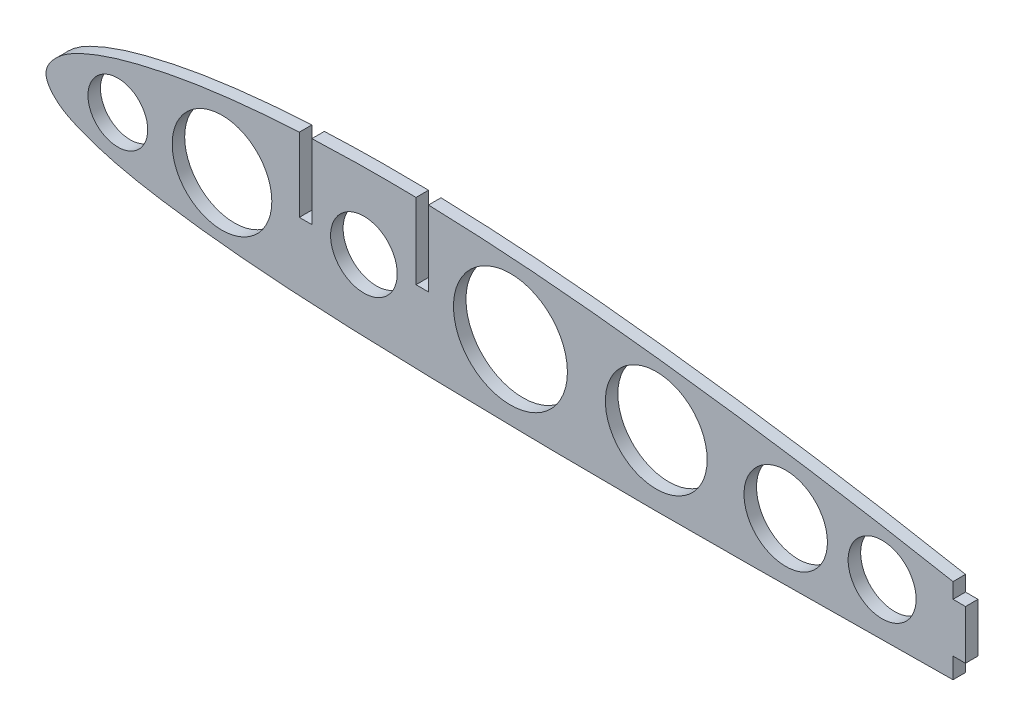
from build123d import *

# Parameters (mm, degrees)
STOCK_WING_STRUCTURESIZING_1_START = 350.5
STOCK_WING_STRUCTURESIZING_1_DEPTH = 3
CUT_EXTRUDE2_DEPTH                 = 278.894871602
CUT_EXTRUDE2_DEPTH_BACK            = 278.894871602
SKETCH3_R                          = 8
SKETCH3_W                          = 3
SKETCH3_H                          = 18.234468085
CUT_EXTRUDE4_DEPTH                 = 278.894871602
CUT_EXTRUDE4_DEPTH_BACK            = 278.894871602
SKETCH5_R                          = 11.95805895
SKETCH5_R_2                        = 7.169372457
SKETCH5_R_3                        = 13.674510634
SKETCH5_R_4                        = 12.212970513
SKETCH5_R_5                        = 10.010351927
SKETCH5_R_6                        = 8.158360338
CUT_EXTRUDE5_DEPTH                 = 278.894871602
CUT_EXTRUDE5_DEPTH_BACK            = 278.894871602
SKETCH6_W                          = 64.732340391
SKETCH6_H                          = 42.731806402
SKETCH7_W                          = 3
SKETCH7_H                          = 9.510615959
SKETCH7_W_2                        = 3.785985864
SKETCH7_H_2                        = 7.964989953
CUT_EXTRUDE6_DEPTH                 = 10


# Read off the part's stored shape, not the designer's step: Stock-Wing_structureSizing-1
with BuildPart() as part:
    # Stock-Wing_structureSizing-1 outline → Stock-Wing_structureSizing-1 (new body)
    with BuildSketch(Plane.XY.offset(STOCK_WING_STRUCTURESIZING_1_START)):
        with BuildLine():
            Line((276.744987748, -9.975467242), (276.744987748, -2.791972149))
            add(Edge.make_bspline(
                [(276.744987748, -2.791972149), (265.3857023, -0.102525952), (253.985388892, 2.407220527), (231.123115134, 7.137179769), (219.66894224, 9.35664169), (202.450532833, 12.449607831), (196.704666185, 13.440005467), (185.197495984, 15.322846112), (179.436018194, 16.214183509), (167.896810084, 17.893728146), (162.119320772, 18.683464695), (150.549559093, 20.169132171), (144.757676972, 20.867539393), (133.154760401, 22.142823058), (127.340720117, 22.719276226), (115.726117513, 23.709424358), (109.921864102, 24.123286294), (92.520744809, 25.054695045), (80.935765142, 25.255529424), (63.589579679, 24.723206588), (57.812696472, 24.40777964), (49.15741104, 23.667136334), (46.27396258, 23.376378774), (40.511150261, 22.68602794), (37.631848569, 22.284778258), (31.878918329, 21.331115885), (29.005409213, 20.775520933), (24.699904445, 19.815325722), (23.265457389, 19.476044022), (20.398415094, 18.74813831), (18.963740816, 18.357002163), (16.106748162, 17.497000764), (14.692710081, 17.03099603), (11.902486035, 16.004726933), (10.526189891, 15.444736939), (8.50012674, 14.509175123), (7.830361802, 14.183402304), (6.512563898, 13.477739544), (5.865248411, 13.093583044), (4.633392785, 12.255605476), (4.045066641, 11.801499914), (3.209118512, 11.061128735), (2.938431583, 10.804207958), (2.416562808, 10.265550671), (2.165207772, 9.983507914), (1.696102707, 9.397220013), (1.477442994, 9.09171798), (1.085439515, 8.447078561), (0.915512906, 8.113897404), (0.714798114, 7.59155933), (0.657190766, 7.413573783), (0.566275814, 7.047480769), (0.533643429, 6.859526942), (0.498702003, 6.485823786), (0.495732967, 6.298500114), (0.52230969, 5.922794269), (0.553180601, 5.733657444), (0.641956646, 5.367254731), (0.699629973, 5.188174612), (0.835770495, 4.836464845), (0.914681224, 4.663114785), (1.173802922, 4.160517642), (1.376431151, 3.845824341), (1.822835658, 3.244491079), (2.068245893, 2.956719217), (2.585349641, 2.410512622), (2.856205808, 2.152934366), (3.699269455, 1.418677094), (4.302923323, 0.981675809), (5.262649419, 0.394618321), (5.591648375, 0.21018796), (6.254696782, -0.135942129), (6.589931521, -0.298692503), (7.602521133, -0.767803382), (8.28593821, -1.057311971), (9.662885491, -1.60821635), (10.357226689, -1.867357708), (12.455074514, -2.603572901), (13.873250521, -3.039868309), (16.739197416, -3.830190303), (18.188973825, -4.184254143), (22.54237297, -5.143962802), (25.459339583, -5.655261329), (31.306270814, -6.564233952), (34.235701619, -6.966574468), (40.104165427, -7.687316125), (43.043386977, -8.004069053), (51.874086741, -8.840379009), (57.778366073, -9.248032718), (66.64804678, -9.743583642), (69.60756187, -9.887823594), (75.525585547, -10.141245843), (78.484610817, -10.250077692), (84.402679828, -10.443151081), (87.361723417, -10.527595381), (93.279819329, -10.684856962), (96.238871496, -10.7578835), (111.034153794, -11.094438823), (122.870449548, -11.270610432), (140.625005024, -11.385979432), (146.54320834, -11.400264082), (158.379650661, -11.381324799), (164.297889136, -11.348805922), (176.134384089, -11.259801078), (182.052639742, -11.204415721), (193.889154401, -11.089178887), (199.807414258, -11.02819544), (217.562198328, -10.839257795), (229.398721047, -10.713290888), (253.0718283, -10.379069852), (264.908412973, -10.164021277), (276.744987748, -9.975467242)],
                knots=[0, 0, 0, 0, 0.0625, 0.0625, 0.125, 0.125, 0.15625, 0.15625, 0.1875, 0.1875, 0.21875, 0.21875, 0.25, 0.25, 0.28125, 0.28125, 0.3125, 0.3125, 0.375, 0.375, 0.40625, 0.40625, 0.421875, 0.421875, 0.4375, 0.4375, 0.453125, 0.453125, 0.4609375, 0.4609375, 0.46875, 0.46875, 0.4765625, 0.4765625, 0.484375, 0.484375, 0.48828125, 0.48828125, 0.4921875, 0.4921875, 0.49609375, 0.49609375, 0.498046875, 0.498046875, 0.5, 0.5, 0.501953125, 0.501953125, 0.50390625, 0.50390625, 0.504882813, 0.504882813, 0.505859375, 0.505859375, 0.506835938, 0.506835938, 0.5078125, 0.5078125, 0.508789063, 0.508789063, 0.509765625, 0.509765625, 0.51171875, 0.51171875, 0.513671875, 0.513671875, 0.515625, 0.515625, 0.51953125, 0.51953125, 0.521484375, 0.521484375, 0.5234375, 0.5234375, 0.52734375, 0.52734375, 0.53125, 0.53125, 0.5390625, 0.5390625, 0.546875, 0.546875, 0.5625, 0.5625, 0.578125, 0.578125, 0.59375, 0.59375, 0.625, 0.625, 0.640625, 0.640625, 0.65625, 0.65625, 0.671875, 0.671875, 0.6875, 0.6875, 0.75, 0.75, 0.78125, 0.78125, 0.8125, 0.8125, 0.84375, 0.84375, 0.875, 0.875, 0.9375, 0.9375, 1, 1, 1, 1], degree=3))
        make_face()
    extrude(amount=STOCK_WING_STRUCTURESIZING_1_DEPTH)

    # Sketch3 → Cut-Extrude2 (cut, two sides: drawn at the far end of the back side and taken through both)
    with BuildSketch(Plane.XY.offset(353.5).offset(-CUT_EXTRUDE2_DEPTH_BACK)):
        with Locations((76.810751166, 6.840845639)):
            Circle(SKETCH3_R)
        with Locations((62.810751166, 15.958079682)):
            Rectangle(SKETCH3_W, SKETCH3_H)
        with Locations((90.810751166, 15.958079682)):
            Rectangle(SKETCH3_W, SKETCH3_H)
    extrude(amount=CUT_EXTRUDE2_DEPTH + CUT_EXTRUDE2_DEPTH_BACK, mode=Mode.SUBTRACT)

    # Sketch5 → Cut-Extrude4 (cut, two sides: drawn at the far end of the back side and taken through both)
    with BuildSketch(Plane.XY.offset(353.5).offset(-CUT_EXTRUDE4_DEPTH_BACK)):
        with Locations((42.745490947, 6.840845639)):
            Circle(SKETCH5_R)
        with Locations((17.744884142, 6.840845639)):
            Circle(SKETCH5_R_2)
        with Locations((111.977940563, 6.840845639)):
            Circle(SKETCH5_R_3)
        with Locations((146.978790092, 5.403682356)):
            Circle(SKETCH5_R_4)
        with Locations((178.04916661, 2.657707021)):
            Circle(SKETCH5_R_5)
        with Locations((201.188673735, 1.494917718)):
            Circle(SKETCH5_R_6)
    extrude(amount=CUT_EXTRUDE4_DEPTH + CUT_EXTRUDE4_DEPTH_BACK, mode=Mode.SUBTRACT)

    # Sketch6 → Cut-Extrude5 (cut, two sides: drawn at the far end of the back side and taken through both)
    with BuildSketch(Plane.XY.offset(353.5).offset(-CUT_EXTRUDE5_DEPTH_BACK)):
        with Locations((253.566170196, -3.625382948)):
            Rectangle(SKETCH6_W, SKETCH6_H)
    extrude(amount=CUT_EXTRUDE5_DEPTH + CUT_EXTRUDE5_DEPTH_BACK, mode=Mode.SUBTRACT)

    # Sketch7 → Cut-Extrude6 (cut)
    with BuildSketch(Plane.XY.offset(353.5)):
        with Locations((219.700001792, -10.65530798)):
            Rectangle(SKETCH7_W, SKETCH7_H)
        with Locations((220.092994724, 9.882494977)):
            Rectangle(SKETCH7_W_2, SKETCH7_H_2)
    extrude(amount=-CUT_EXTRUDE6_DEPTH, mode=Mode.SUBTRACT)


solid = part.part
